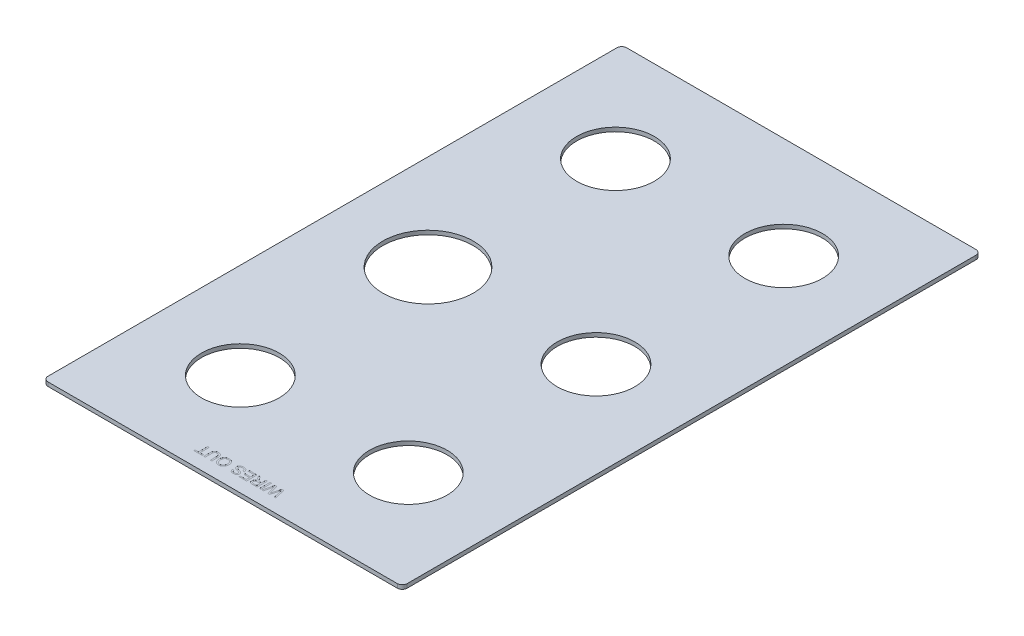
from build123d import *

# Parameters (mm, degrees)
SKETCH1_R           = 24.727
SKETCH1_R_2         = 28.76928198
BOSS_EXTRUDE1_DEPTH = 2.54
SKETCH2_W           = 0.941716851
SKETCH2_H           = 6.677628581
CUT_EXTRUDE2_DEPTH  = 0.0254


with BuildPart() as part:
    # Sketch1 → Boss-Extrude1 (new body)
    with BuildSketch(Plane(origin=(0, 0, 0), x_dir=(1, 0, 0), z_dir=(0, 1, 0))):
        with BuildLine():
            Line((-111.125, 184.15), (111.125, 184.15))
            ThreePointArc((111.125, 184.15), (113.37006403, 183.22006403), (114.3, 180.975))
            Line((114.3, 180.975), (114.3, -180.975))
            ThreePointArc((114.3, -180.975), (113.37006403, -183.22006403), (111.125, -184.15))
            Line((111.125, -184.15), (-111.125, -184.15))
            ThreePointArc((-111.125, -184.15), (-113.37006403, -183.22006403), (-114.3, -180.975))
            Line((-114.3, -180.975), (-114.3, 180.975))
            ThreePointArc((-114.3, 180.975), (-113.37006403, 183.22006403), (-111.125, 184.15))
        make_face()
        with Locations((53.5178, -119.508581684)):
            Circle(SKETCH1_R, mode=Mode.SUBTRACT)
        with Locations((53.5178, -0.064290842)):
            Circle(SKETCH1_R, mode=Mode.SUBTRACT)
        with Locations((-53.5178, -119.38)):
            Circle(SKETCH1_R, mode=Mode.SUBTRACT)
        with Locations((-53.5178, 119.38)):
            Circle(SKETCH1_R, mode=Mode.SUBTRACT)
        with Locations((53.5178, 119.38)):
            Circle(SKETCH1_R, mode=Mode.SUBTRACT)
        with Locations((-53.5178, 0.064290842)):
            Circle(SKETCH1_R_2, mode=Mode.SUBTRACT)
    extrude(amount=BOSS_EXTRUDE1_DEPTH)

    # Sketch2 → Cut-Extrude2 (cut)
    # profile 1 of 8: a face of its own
    with BuildSketch(Plane(origin=(0, 2.54, 0), x_dir=(1, 0, 0), z_dir=(0, 1, 0))):
        with BuildLine():
            Line((23.632943238, -168.91), (25.314389377, -175.587628581))
            Line((25.314389377, -175.587628581), (24.341906208, -175.587628581))
            Line((24.341906208, -175.587628581), (23.350695716, -171.196071163))
            add(Edge.make_bspline(
                [(23.350695716, -171.196071163), (23.299325023, -170.969580808), (23.19710809, -170.518912379), (23.096001693, -170.067993508), (23.045707872, -169.843690855)],
                knots=[0, 0, 0, 0, 1.00513078, 2, 2, 2, 2], degree=3))
            add(Edge.make_bspline(
                [(23.045707872, -169.843690855), (23.021895326, -169.924344538), (22.976941578, -170.076603994), (22.916172822, -170.292446444), (22.860978508, -170.480827734), (22.813955785, -170.642626067), (22.775881668, -170.778068762), (22.743008908, -170.885491505), (22.720603246, -170.966997983), (22.70732561, -171.011932775), (22.701927715, -171.030200581)],
                knots=[0, 0, 0, 0, 1.633809233, 3.084334118, 4.356383392, 5.447555203, 6.357852567, 7.089694452, 7.629924063, 8, 8, 8, 8], degree=3))
            Line((22.701927715, -171.030200581), (21.382989057, -175.587628581))
            Line((21.382989057, -175.587628581), (20.24998597, -175.587628581))
            Line((20.24998597, -175.587628581), (19.296230125, -172.24212596))
            add(Edge.make_bspline(
                [(19.296230125, -172.24212596), (19.243596084, -172.03545393), (19.139813145, -171.627941413), (19.001920759, -171.020936424), (18.874650495, -170.428657498), (18.801340432, -170.036929476), (18.765176731, -169.843690855)],
                knots=[0, 0, 0, 0, 1.04154457, 2.053700482, 3.039894486, 4, 4, 4, 4], degree=3))
            add(Edge.make_bspline(
                [(18.765176731, -169.843690855), (18.742796194, -169.942212876), (18.695517606, -170.150339344), (18.622811501, -170.478808574), (18.540293141, -170.839224554), (18.484149649, -171.09036912), (18.454838223, -171.221486816)],
                knots=[0, 0, 0, 0, 0.858436457, 1.813435672, 2.858437265, 4, 4, 4, 4], degree=3))
            Line((18.454838223, -171.221486816), (17.468978394, -175.587628581))
            Line((17.468978394, -175.587628581), (16.496495226, -175.587628581))
            Line((16.496495226, -175.587628581), (18.179279031, -168.91))
            Line((18.179279031, -168.91), (19.214632501, -168.91))
            Line((19.214632501, -168.91), (20.609818119, -174.01319572))
            add(Edge.make_bspline(
                [(20.609818119, -174.01319572), (20.623827793, -174.063084201), (20.650440955, -174.157853738), (20.685324579, -174.29309308), (20.719917615, -174.412030516), (20.747432964, -174.516203119), (20.771245195, -174.604561153), (20.792331944, -174.676845919), (20.805894374, -174.734472146), (20.815702094, -174.76722518), (20.819831679, -174.781015994)],
                knots=[0, 0, 0, 0, 1.562239628, 2.967673567, 4.210417925, 5.296319877, 6.215971374, 6.969386481, 7.566055473, 8, 8, 8, 8], degree=3))
            add(Edge.make_bspline(
                [(20.819831679, -174.781015994), (20.844657297, -174.693580195), (20.891682413, -174.527957792), (20.960166786, -174.295091919), (21.019046174, -174.090752029), (21.055687775, -173.96458835), (21.072650549, -173.906182442)],
                knots=[0, 0, 0, 0, 1.197732026, 2.268764715, 3.198546125, 4, 4, 4, 4], degree=3))
            Line((21.072650549, -173.906182442), (22.518667475, -168.91))
            Line((22.518667475, -168.91), (23.632943238, -168.91))
        make_face()
    # profile 2 of 8: a face of its own
    with BuildSketch(Plane(origin=(0, 2.54, 0), x_dir=(1, 0, 0), z_dir=(0, 1, 0))):
        with Locations((15.340751818, -172.248814291)):
            Rectangle(SKETCH2_W, SKETCH2_H)
    # profile 3 of 8: a face of its own
    with BuildSketch(Plane(origin=(0, 2.54, 0), x_dir=(1, 0, 0), z_dir=(0, 1, 0))):
        with BuildLine():
            Line((13.328902181, -168.91), (13.328902181, -175.587628581))
            Line((13.328902181, -175.587628581), (10.431517665, -175.587628581))
            add(Edge.make_bspline(
                [(10.431517665, -175.587628581), (10.363292806, -175.587096546), (10.231251578, -175.586066856), (10.03976983, -175.578708935), (9.861463117, -175.563077027), (9.695207674, -175.545618097), (9.541287988, -175.519839646), (9.399630705, -175.489596873), (9.270779114, -175.453853433), (9.153752793, -175.411603204), (9.045169062, -175.363819062), (8.944548789, -175.304828573), (8.847571535, -175.240298913), (8.758103027, -175.163854788), (8.672113635, -175.08172384), (8.593203482, -174.989796624), (8.519037225, -174.890373993), (8.428860855, -174.746400185), (8.334151114, -174.553413553), (8.252576009, -174.308226002), (8.200705014, -174.05148519), (8.195105726, -173.876110271), (8.192264811, -173.787130169)],
                knots=[0, 0, 0, 0, 1.242075696, 2.40389213, 3.487198984, 4.500157661, 5.446319301, 6.326791195, 7.136300648, 7.878370406, 8.590488565, 9.292260633, 9.999224673, 10.708050372, 11.431369221, 12.162165018, 12.910600795, 13.687589445, 15.252257874, 16.810406251, 18.381693487, 20, 20, 20, 20], degree=3))
            add(Edge.make_bspline(
                [(8.192264811, -173.787130169), (8.193571517, -173.730008672), (8.19615235, -173.617189797), (8.215921505, -173.45131567), (8.251692958, -173.292830312), (8.297560289, -173.14034246), (8.360348032, -172.996024572), (8.433051662, -172.856884453), (8.523248176, -172.726910071), (8.623957418, -172.601757556), (8.741064038, -172.487074803), (8.871326311, -172.381080347), (9.018660448, -172.290119283), (9.178234156, -172.205586967), (9.354159906, -172.136163929), (9.54378457, -172.075034695), (9.748575738, -172.02790233), (9.890519546, -172.004161241), (9.963334571, -171.991982422)],
                knots=[0, 0, 0, 0, 0.982645791, 1.940792824, 2.867691729, 3.775150443, 4.675643875, 5.571354211, 6.471357401, 7.392684514, 8.331098131, 9.285922955, 10.275520706, 11.304845665, 12.388884831, 13.524255008, 14.729980297, 16, 16, 16, 16], degree=3))
            add(Edge.make_bspline(
                [(9.963334571, -171.991982422), (9.909404212, -171.965100634), (9.80713011, -171.914121729), (9.667956952, -171.829773388), (9.546035076, -171.750366643), (9.476778417, -171.69082278), (9.44432017, -171.66291659)],
                knots=[0, 0, 0, 0, 1.172551213, 2.223638478, 3.167479604, 4, 4, 4, 4], degree=3))
            add(Edge.make_bspline(
                [(9.44432017, -171.66291659), (9.381132019, -171.601164157), (9.251543527, -171.474520084), (9.074703105, -171.256807636), (8.899721615, -171.017386254), (8.794666383, -170.842915484), (8.740707864, -170.753303723)],
                knots=[0, 0, 0, 0, 0.918170575, 1.883016652, 2.912673989, 4, 4, 4, 4], degree=3))
            Line((8.740707864, -170.753303723), (7.645159425, -168.91))
            Line((7.645159425, -168.91), (8.724655872, -168.91))
            Line((8.724655872, -168.91), (9.556684113, -170.319899945))
            add(Edge.make_bspline(
                [(9.556684113, -170.319899945), (9.586601501, -170.369366751), (9.644576487, -170.465225299), (9.728289267, -170.605242248), (9.810477346, -170.734077121), (9.886334988, -170.85574056), (9.960672974, -170.96702405), (10.027312005, -171.072139162), (10.094234973, -171.165131078), (10.171077393, -171.276850283), (10.264921144, -171.397638948), (10.374430167, -171.52172404), (10.475116427, -171.624510619), (10.602349215, -171.722582681), (10.760556516, -171.812377229), (10.893947832, -171.85497336), (10.958558061, -171.875605481)],
                knots=[0, 0, 0, 0, 1.130591283, 2.190900266, 3.190104209, 4.119071823, 4.994606968, 5.807262858, 6.55236009, 7.234593472, 8.459046683, 9.540234366, 10.471327768, 11.266723835, 12.676093724, 14, 14, 14, 14], degree=3))
            add(Edge.make_bspline(
                [(10.958558061, -171.875605481), (10.985700699, -171.880500221), (11.047668153, -171.891675059), (11.152888735, -171.898973364), (11.28037638, -171.906719538), (11.372768849, -171.90649384), (11.422728157, -171.906371799)],
                knots=[0, 0, 0, 0, 0.709978628, 1.620902492, 2.713552433, 4, 4, 4, 4], degree=3))
            Line((11.422728157, -171.906371799), (12.38718533, -171.906371799))
            Line((12.38718533, -171.906371799), (12.38718533, -168.91))
            Line((12.38718533, -168.91), (13.328902181, -168.91))
        make_face()
        with BuildLine():
            Line((12.38718533, -172.676867405), (10.598725912, -172.676867405))
            add(Edge.make_bspline(
                [(10.598725912, -172.676867405), (10.509041729, -172.678258399), (10.341385561, -172.680858734), (10.10700453, -172.703403287), (9.906514669, -172.738643655), (9.737355011, -172.792167838), (9.595192811, -172.86384728), (9.4719805, -172.951504301), (9.368380463, -173.060253453), (9.28317838, -173.184950494), (9.216573602, -173.320844399), (9.170033561, -173.464671415), (9.138788207, -173.613673587), (9.135593421, -173.715629033), (9.133981662, -173.76706518)],
                knots=[0, 0, 0, 0, 1.546056516, 2.890207646, 4.055830773, 5.050253158, 5.937355789, 6.790906573, 7.644595853, 8.512568064, 9.38593768, 10.244184789, 11.114197691, 12, 12, 12, 12], degree=3))
            add(Edge.make_bspline(
                [(9.133981662, -173.76706518), (9.135218998, -173.804549755), (9.137642576, -173.877971028), (9.150482994, -173.985697904), (9.174913004, -174.087786542), (9.208647521, -174.184972845), (9.251360342, -174.27746782), (9.303847642, -174.364907678), (9.36583859, -174.446845812), (9.436949475, -174.523685608), (9.518568997, -174.593612923), (9.611805656, -174.653942185), (9.715914915, -174.705209834), (9.83102038, -174.745899051), (9.956758704, -174.778443865), (10.093845904, -174.800094864), (10.241654987, -174.815761459), (10.344078112, -174.816667262), (10.396738349, -174.817132975)],
                knots=[0, 0, 0, 0, 0.965235723, 1.89061323, 2.787065514, 3.661873922, 4.534873316, 5.404925039, 6.281839248, 7.175200054, 8.095223355, 9.040740021, 10.02630299, 11.075573487, 12.177989335, 13.364883635, 14.645170704, 16, 16, 16, 16], degree=3))
            Line((10.396738349, -174.817132975), (12.38718533, -174.817132975))
            Line((12.38718533, -174.817132975), (12.38718533, -172.676867405))
        make_face(mode=Mode.SUBTRACT)
    # profile 4 of 8: a face of its own
    with BuildSketch(Plane(origin=(0, 2.54, 0), x_dir=(1, 0, 0), z_dir=(0, 1, 0))):
        Polygon((6.6512736, -168.91), (6.6512736, -175.587628581), (1.942689345, -175.587628581), (1.942689345, -174.817132975), (5.709556749, -174.817132975), (5.709556749, -172.762478027), (2.199521213, -172.762478027), (2.199521213, -171.991982422), (5.709556749, -171.991982422), (5.709556749, -169.680495605), (1.771468099, -169.680495605), (1.771468099, -168.91), align=None)
    # profile 5 of 8: a face of its own
    with BuildSketch(Plane(origin=(0, 2.54, 0), x_dir=(1, 0, 0), z_dir=(0, 1, 0))):
        with BuildLine():
            Line((0.829751248, -171.221486816), (-0.111965603, -171.221486816))
            add(Edge.make_bspline(
                [(-0.111965603, -171.221486816), (-0.122300306, -171.136920767), (-0.142153826, -170.974464831), (-0.198105729, -170.744412505), (-0.268592025, -170.537033889), (-0.361338467, -170.352541821), (-0.475255133, -170.186545829), (-0.617782751, -170.039543528), (-0.788933822, -169.910501137), (-0.984673261, -169.800161916), (-1.198851792, -169.707216884), (-1.429578835, -169.642014332), (-1.673439367, -169.602475454), (-1.840524353, -169.597450703), (-1.925840675, -169.594884983)],
                knots=[0, 0, 0, 0, 1.125761249, 2.162647979, 3.12492346, 4.01623828, 4.884793378, 5.777219259, 6.711258599, 7.709587174, 8.742442187, 9.791331093, 10.872217593, 12, 12, 12, 12], degree=3))
            add(Edge.make_bspline(
                [(-1.925840675, -169.594884983), (-2.00132428, -169.596288662), (-2.148061054, -169.599017353), (-2.361175224, -169.631583172), (-2.561144255, -169.679761442), (-2.745807794, -169.749052862), (-2.911454681, -169.836152826), (-3.058487465, -169.935607161), (-3.180435603, -170.054131077), (-3.279079502, -170.185129954), (-3.35563269, -170.324239119), (-3.409002883, -170.467751543), (-3.444935193, -170.612872597), (-3.448840901, -170.711184835), (-3.450779894, -170.759992053)],
                knots=[0, 0, 0, 0, 1.267544124, 2.464049433, 3.614542348, 4.719673496, 5.768837234, 6.754183997, 7.692231426, 8.612479311, 9.501217876, 10.350240008, 11.180974857, 12, 12, 12, 12], degree=3))
            add(Edge.make_bspline(
                [(-3.450779894, -170.759992053), (-3.448734217, -170.808320403), (-3.444731839, -170.90287513), (-3.41298182, -171.039749764), (-3.361676939, -171.167107787), (-3.289708786, -171.286035669), (-3.191897669, -171.39581424), (-3.065416139, -171.493264907), (-2.913787566, -171.585956174), (-2.799626619, -171.635388546), (-2.739141591, -171.661578924)],
                knots=[0, 0, 0, 0, 0.942081658, 1.843188798, 2.725198023, 3.611401405, 4.541884661, 5.575766242, 6.715586633, 8, 8, 8, 8], degree=3))
            add(Edge.make_bspline(
                [(-2.739141591, -171.661578924), (-2.715616019, -171.671233178), (-2.662467478, -171.693043891), (-2.571372485, -171.721914532), (-2.463281361, -171.75926362), (-2.335982467, -171.797529049), (-2.189343903, -171.83852873), (-2.02471077, -171.885712807), (-1.840776969, -171.934847595), (-1.643984004, -171.986863987), (-1.444785638, -172.039623623), (-1.254502177, -172.093569336), (-1.078352587, -172.144734389), (-0.917007378, -172.197320494), (-0.770312038, -172.249221233), (-0.637865794, -172.300101227), (-0.519433039, -172.34869434), (-0.447100591, -172.384431007), (-0.412940449, -172.401308212)],
                knots=[0, 0, 0, 0, 0.499208779, 1.12780332, 1.87546358, 2.745246929, 3.737578632, 4.865834649, 6.108484299, 7.476352792, 8.863398792, 10.155242256, 11.360521946, 12.465428895, 13.487415091, 14.415997097, 15.251929613, 16, 16, 16, 16], degree=3))
            add(Edge.make_bspline(
                [(-0.412940449, -172.401308212), (-0.33439709, -172.443817677), (-0.182787966, -172.525872006), (0.022051427, -172.671714273), (0.19175084, -172.836704186), (0.331696087, -173.014473096), (0.439742994, -173.205942272), (0.516080243, -173.409014609), (0.565656107, -173.622897826), (0.570471317, -173.769909024), (0.572919379, -173.844649807)],
                knots=[0, 0, 0, 0, 1.158956011, 2.237086722, 3.252429106, 4.221720014, 5.165272549, 6.094237939, 7.031106807, 8, 8, 8, 8], degree=3))
            add(Edge.make_bspline(
                [(0.572919379, -173.844649807), (0.5697455, -173.927437968), (0.563432677, -174.092103021), (0.507294577, -174.333691375), (0.417883054, -174.56692136), (0.314888491, -174.751512006), (0.215916434, -174.891668806), (0.132735448, -174.991049213), (0.04094839, -175.083472006), (-0.057437483, -175.170854779), (-0.165974497, -175.249930177), (-0.281411584, -175.323343203), (-0.406113443, -175.38912905), (-0.582665272, -175.469334226), (-0.817493636, -175.551565656), (-1.113162554, -175.622810202), (-1.424366052, -175.664515975), (-1.636779572, -175.670290332), (-1.745255767, -175.673239204)],
                knots=[0, 0, 0, 0, 1.200056028, 2.386902731, 3.579012093, 4.815906327, 5.442508847, 6.067203999, 6.694073756, 7.331409728, 7.974631341, 8.640655778, 9.315145047, 10.018831381, 11.453504181, 12.917815188, 14.425977399, 16, 16, 16, 16], degree=3))
            add(Edge.make_bspline(
                [(-1.745255767, -175.673239204), (-1.864008344, -175.670604036), (-2.094800286, -175.665482671), (-2.430387838, -175.620316752), (-2.744325301, -175.547538362), (-2.990076794, -175.461794803), (-3.172239093, -175.376566745), (-3.300639933, -175.307887436), (-3.420230957, -175.230485202), (-3.533294276, -175.14853061), (-3.635789241, -175.056685259), (-3.731948999, -174.959779443), (-3.820155827, -174.855945122), (-3.924903958, -174.707643741), (-4.03554884, -174.509311317), (-4.135470952, -174.254928517), (-4.199457348, -173.984452318), (-4.213925457, -173.798607284), (-4.221275499, -173.704194878)],
                knots=[0, 0, 0, 0, 1.607451709, 3.124032445, 4.575401297, 5.965664223, 6.638286369, 7.297495781, 7.935629741, 8.566004073, 9.186263309, 9.796807256, 10.413736732, 11.028594479, 12.253110936, 13.478624344, 14.719098735, 16, 16, 16, 16], degree=3))
            Line((-4.221275499, -173.704194878), (-3.279558648, -173.704194878))
            add(Edge.make_bspline(
                [(-3.279558648, -173.704194878), (-3.273771602, -173.752058718), (-3.262436422, -173.845810392), (-3.230636994, -173.980547909), (-3.192600267, -174.10710359), (-3.144232188, -174.224055068), (-3.086506247, -174.332436506), (-3.018033712, -174.431011758), (-2.94152464, -174.521646465), (-2.85513315, -174.602750037), (-2.758041884, -174.673975704), (-2.650230509, -174.735532482), (-2.532098757, -174.788145122), (-2.402500751, -174.828705316), (-2.26316937, -174.862387332), (-2.112501629, -174.886565121), (-1.951024251, -174.899089809), (-1.839803256, -174.901504216), (-1.782710414, -174.902743598)],
                knots=[0, 0, 0, 0, 1.074256797, 2.104164074, 3.082231143, 4.018364317, 4.921387537, 5.814946689, 6.689553043, 7.561782592, 8.450683137, 9.368204304, 10.325224224, 11.328240899, 12.391723181, 13.519579538, 14.726730929, 16, 16, 16, 16], degree=3))
            add(Edge.make_bspline(
                [(-1.782710414, -174.902743598), (-1.723364228, -174.902302171), (-1.608484606, -174.901447678), (-1.442447663, -174.885584388), (-1.288428272, -174.864200282), (-1.147375889, -174.8313749), (-1.017974289, -174.79275508), (-0.902493225, -174.740895859), (-0.798180298, -174.682436669), (-0.706937899, -174.61391263), (-0.62829401, -174.537943815), (-0.557710091, -174.459906863), (-0.500797494, -174.375719234), (-0.450683023, -174.290042614), (-0.415765366, -174.198320253), (-0.388355797, -174.104542703), (-0.371689275, -174.006649151), (-0.369774726, -173.940134121), (-0.368797472, -173.906182442)],
                knots=[0, 0, 0, 0, 1.464224776, 2.834379057, 4.11387117, 5.299348816, 6.406355048, 7.441191667, 8.417293255, 9.352838038, 10.248153785, 11.113750317, 11.944205591, 12.75240885, 13.557683963, 14.358962649, 15.162355132, 16, 16, 16, 16], degree=3))
            add(Edge.make_bspline(
                [(-0.368797472, -173.906182442), (-0.37123109, -173.848731061), (-0.375954518, -173.737223227), (-0.424187626, -173.578804208), (-0.498370483, -173.434395009), (-0.571452417, -173.3558227), (-0.608239683, -173.316271744)],
                knots=[0, 0, 0, 0, 1.050964922, 2.039826012, 3.013306874, 4, 4, 4, 4], degree=3))
            add(Edge.make_bspline(
                [(-0.608239683, -173.316271744), (-0.631429982, -173.296506065), (-0.682713897, -173.252795485), (-0.778135549, -173.194949737), (-0.89644413, -173.136503535), (-1.038430802, -173.078405591), (-1.203848303, -173.019938836), (-1.392443217, -172.959783733), (-1.605290389, -172.899729949), (-1.835341443, -172.842797028), (-2.06742145, -172.784340103), (-2.287668031, -172.726739864), (-2.490671798, -172.672911415), (-2.674095348, -172.616871264), (-2.840956873, -172.567716205), (-2.987948727, -172.515816054), (-3.11771171, -172.468717275), (-3.19717772, -172.435472738), (-3.234078005, -172.420035536)],
                knots=[0, 0, 0, 0, 0.523895407, 1.158562347, 1.913798076, 2.79478753, 3.797549825, 4.933675542, 6.202127117, 7.604032848, 9.013379355, 10.32225155, 11.523321485, 12.628397413, 13.623935419, 14.51727859, 15.311493772, 16, 16, 16, 16], degree=3))
            add(Edge.make_bspline(
                [(-3.234078005, -172.420035536), (-3.282099123, -172.397911246), (-3.376356532, -172.354484974), (-3.509729216, -172.280126565), (-3.634989015, -172.203572345), (-3.748235425, -172.119213657), (-3.855033152, -172.034742137), (-3.949935026, -171.943421237), (-4.03498244, -171.847399774), (-4.135724875, -171.715469781), (-4.239063497, -171.53739795), (-4.32785, -171.307252493), (-4.383388253, -171.061361326), (-4.389423008, -170.891824444), (-4.392496745, -170.805472696)],
                knots=[0, 0, 0, 0, 0.899363591, 1.76530001, 2.59691609, 3.395188894, 4.166615117, 4.912545108, 5.632755751, 6.347510175, 7.734752518, 9.118421309, 10.532299558, 12, 12, 12, 12], degree=3))
            add(Edge.make_bspline(
                [(-4.392496745, -170.805472696), (-4.38895673, -170.718216064), (-4.381910949, -170.544547011), (-4.323029718, -170.288939319), (-4.228552762, -170.041766988), (-4.119204846, -169.845674821), (-4.015428246, -169.695673965), (-3.928279472, -169.587851279), (-3.831628839, -169.488155207), (-3.727864782, -169.393458837), (-3.616178846, -169.30569683), (-3.495631673, -169.224832572), (-3.367489359, -169.150049501), (-3.184530779, -169.058819838), (-2.941241491, -168.964081688), (-2.632292045, -168.881909663), (-2.305506818, -168.833218795), (-2.081621479, -168.827373774), (-1.96730832, -168.824389377)],
                knots=[0, 0, 0, 0, 1.196987384, 2.382393894, 3.582009067, 4.820735309, 5.454243406, 6.085350439, 6.72189866, 7.359035515, 8.013098289, 8.67027723, 9.350744424, 10.048966745, 11.475869723, 12.9268444, 14.430883741, 16, 16, 16, 16], degree=3))
            add(Edge.make_bspline(
                [(-1.96730832, -168.824389377), (-1.894611976, -168.825066361), (-1.751765216, -168.82639662), (-1.542326645, -168.839585244), (-1.342192809, -168.863413354), (-1.150563024, -168.89099369), (-0.968341294, -168.932446252), (-0.794482035, -168.979218191), (-0.63057113, -169.037895171), (-0.474803619, -169.102452696), (-0.328605544, -169.178733963), (-0.188907253, -169.260489596), (-0.059089327, -169.354273292), (0.064694543, -169.453730246), (0.178709516, -169.564374285), (0.284274783, -169.683623433), (0.382537737, -169.811206702), (0.471756298, -169.94726202), (0.551403598, -170.090229329), (0.623106063, -170.237623704), (0.683111758, -170.390231372), (0.732561435, -170.547693563), (0.773039531, -170.709295471), (0.801901647, -170.876113556), (0.822853734, -171.04710129), (0.827438496, -171.163014962), (0.829751248, -171.221486816)],
                knots=[0, 0, 0, 0, 1.259929758, 2.475735005, 3.634725603, 4.752877801, 5.82919746, 6.871690464, 7.871395985, 8.84458164, 9.791640072, 10.727373556, 11.647336026, 12.564665335, 13.477425593, 14.397128332, 15.323044476, 16.266184727, 17.214251675, 18.157898412, 19.105082968, 20.053433368, 21.01687335, 21.990151059, 22.98614553, 24, 24, 24, 24], degree=3))
        make_face()
    # profile 6 of 8: a face of its own
    with BuildSketch(Plane(origin=(0, 2.54, 0), x_dir=(1, 0, 0), z_dir=(0, 1, 0))):
        with BuildLine():
            add(Edge.make_bspline(
                [(-7.902532281, -172.160528336), (-7.904868823, -172.294404113), (-7.909421457, -172.555254276), (-7.95145786, -172.935167661), (-8.020805874, -173.292189836), (-8.116201245, -173.627972316), (-8.243080235, -173.939982669), (-8.393628601, -174.232057602), (-8.576292795, -174.499113512), (-8.782691478, -174.744238191), (-9.013292565, -174.960926501), (-9.258801186, -175.153382006), (-9.5223022, -175.313911345), (-9.801356042, -175.446456), (-10.097149626, -175.54821986), (-10.408852094, -175.619463844), (-10.73613018, -175.665423132), (-10.959832408, -175.670596003), (-11.074138323, -175.673239204)],
                knots=[0, 0, 0, 0, 1.203593535, 2.345140965, 3.431924157, 4.471254512, 5.478692091, 6.45615896, 7.42038538, 8.382007041, 9.33218277, 10.260966195, 11.182476517, 12.100814648, 13.034113903, 13.98924309, 14.972556454, 16, 16, 16, 16], degree=3))
            add(Edge.make_bspline(
                [(-11.074138323, -175.673239204), (-11.149533304, -175.671934631), (-11.2992541, -175.669343985), (-11.521000104, -175.649238618), (-11.736781479, -175.614330091), (-11.946724691, -175.565766742), (-12.151139417, -175.504669011), (-12.349890712, -175.429209665), (-12.543296166, -175.340933857), (-12.72962409, -175.238335871), (-12.907551192, -175.122886619), (-13.076351255, -174.997786024), (-13.233401839, -174.860524933), (-13.379460856, -174.712925043), (-13.515657342, -174.555062251), (-13.637638745, -174.383988246), (-13.752624989, -174.205105922), (-13.853438417, -174.014308827), (-13.944828148, -173.81598128), (-14.021432258, -173.609263699), (-14.089271715, -173.397118639), (-14.144048276, -173.178228466), (-14.184879158, -172.951968662), (-14.216276445, -172.719965089), (-14.233230262, -172.480928323), (-14.236209714, -172.319734193), (-14.23771837, -172.238112963)],
                knots=[0, 0, 0, 0, 1.034176269, 2.053687022, 3.051235935, 4.030520976, 5.007759882, 5.975670013, 6.944584641, 7.921900115, 8.890679583, 9.85222947, 10.801660264, 11.7488817, 12.698942795, 13.658174729, 14.62880618, 15.613957309, 16.61577279, 17.622338666, 18.636016077, 19.670029534, 20.714984856, 21.788550191, 22.880224384, 24, 24, 24, 24], degree=3))
            add(Edge.make_bspline(
                [(-14.23771837, -172.238112963), (-14.23632704, -172.155147409), (-14.233578228, -171.991234652), (-14.214978638, -171.749085358), (-14.182274095, -171.513887669), (-14.138897087, -171.284940267), (-14.08077322, -171.062719774), (-14.011701935, -170.846589067), (-13.928156318, -170.637835469), (-13.833800806, -170.435955826), (-13.727037631, -170.243726737), (-13.609270434, -170.062492165), (-13.480416558, -169.893948118), (-13.342430464, -169.736024416), (-13.192553381, -169.591989944), (-13.031942973, -169.459700845), (-12.860927681, -169.339726304), (-12.680177856, -169.23135865), (-12.492581258, -169.136071154), (-12.300415691, -169.051863457), (-12.103454523, -168.983732216), (-11.904579332, -168.923302758), (-11.700828725, -168.879850893), (-11.494123972, -168.847472249), (-11.283166388, -168.828538825), (-11.141503927, -168.825779634), (-11.070125326, -168.824389377)],
                knots=[0, 0, 0, 0, 1.141458971, 2.255149016, 3.338763392, 4.407145747, 5.45911027, 6.497028761, 7.526847988, 8.550472592, 9.561035647, 10.549629976, 11.521388012, 12.477647518, 13.432134385, 14.377847498, 15.337760086, 16.303574593, 17.274809663, 18.230970776, 19.187525402, 20.140611526, 21.088808525, 22.051011914, 23.017975238, 24, 24, 24, 24], degree=3))
            add(Edge.make_bspline(
                [(-11.070125326, -168.824389377), (-10.993387527, -168.825578265), (-10.841389166, -168.827933154), (-10.616494071, -168.849614076), (-10.397937614, -168.88672926), (-10.184469546, -168.93331902), (-9.978465382, -168.998729636), (-9.778201489, -169.075799462), (-9.585162533, -169.169065442), (-9.398356806, -169.274423347), (-9.219457707, -169.39122805), (-9.052258186, -169.52060398), (-8.894291212, -169.6580082), (-8.750367804, -169.808767929), (-8.616177575, -169.968166885), (-8.492171182, -170.137588378), (-8.380100815, -170.317881087), (-8.280587519, -170.508080587), (-8.190852932, -170.703360022), (-8.115208666, -170.90361748), (-8.048743226, -171.105945631), (-7.995807462, -171.311579843), (-7.953624841, -171.520048878), (-7.92525991, -171.731005018), (-7.90477459, -171.944762669), (-7.903283479, -172.088244511), (-7.902532281, -172.160528336)],
                knots=[0, 0, 0, 0, 1.072846099, 2.125039441, 3.155166917, 4.171599398, 5.177324298, 6.174217088, 7.169783185, 8.172042761, 9.17156421, 10.154239632, 11.126115549, 12.096189878, 13.065322046, 14.038037562, 15.029377678, 16.03062832, 17.03785952, 18.032507603, 19.022297599, 20.014323703, 20.999862951, 21.994471951, 22.989647507, 24, 24, 24, 24], degree=3))
        make_face()
        with BuildLine():
            add(Edge.make_bspline(
                [(-8.844249132, -172.149827008), (-8.845691451, -172.053420401), (-8.848503871, -171.865434323), (-8.880709052, -171.591367712), (-8.929517803, -171.332745434), (-8.996992393, -171.088962695), (-9.0870792, -170.861811602), (-9.197220938, -170.650855955), (-9.32641992, -170.455098662), (-9.474608164, -170.276758173), (-9.637434381, -170.116495336), (-9.811433573, -169.976453044), (-9.996444093, -169.859676631), (-10.190016428, -169.762138022), (-10.394717097, -169.686984881), (-10.609565389, -169.633858343), (-10.83455709, -169.60069725), (-10.98796563, -169.596846543), (-11.066112328, -169.594884983)],
                knots=[0, 0, 0, 0, 1.215616022, 2.370365452, 3.475740397, 4.533490648, 5.5560781, 6.552384115, 7.530550651, 8.509299237, 9.471863928, 10.40830403, 11.321168121, 12.226759389, 13.137923578, 14.065605683, 15.014614662, 16, 16, 16, 16], degree=3))
            add(Edge.make_bspline(
                [(-11.066112328, -169.594884983), (-11.145584318, -169.59687414), (-11.301190252, -169.600768903), (-11.529564036, -169.633370577), (-11.746544715, -169.688873529), (-11.954282865, -169.762760558), (-12.149023112, -169.862643127), (-12.335318626, -169.979605429), (-12.508095682, -170.122528616), (-12.671577088, -170.283079607), (-12.818263713, -170.465554814), (-12.948207868, -170.665555052), (-13.054493607, -170.8855657), (-13.143154965, -171.12242268), (-13.21270247, -171.377612405), (-13.261322688, -171.651132636), (-13.291306379, -171.942262372), (-13.294408799, -172.142171822), (-13.296001519, -172.244801292)],
                knots=[0, 0, 0, 0, 0.976909331, 1.912785716, 2.828990727, 3.727421029, 4.617481149, 5.514840137, 6.426786422, 7.368873452, 8.327895072, 9.299698503, 10.295216142, 11.325792517, 12.405818789, 13.542541501, 14.738390493, 16, 16, 16, 16], degree=3))
            add(Edge.make_bspline(
                [(-13.296001519, -172.244801292), (-13.295432936, -172.310823356), (-13.294317582, -172.440334751), (-13.279546538, -172.631236025), (-13.260493814, -172.816199196), (-13.231485645, -172.994985502), (-13.191509057, -173.166854888), (-13.147220595, -173.333114569), (-13.091843858, -173.492336242), (-13.028995551, -173.645128244), (-12.958725969, -173.790764274), (-12.879266751, -173.927807016), (-12.79230587, -174.056711184), (-12.69694247, -174.17690135), (-12.595587364, -174.290074697), (-12.48501404, -174.393289023), (-12.367044024, -174.488597735), (-12.241662552, -174.575025805), (-12.110881776, -174.652718043), (-11.975365427, -174.719721399), (-11.835545168, -174.776527398), (-11.691564755, -174.821039592), (-11.544290507, -174.857788881), (-11.393367263, -174.885010337), (-11.237612443, -174.899281733), (-11.132575308, -174.901581356), (-11.079488987, -174.902743598)],
                knots=[0, 0, 0, 0, 1.220320263, 2.393826742, 3.538159925, 4.657606474, 5.739544833, 6.799495376, 7.837090465, 8.853610905, 9.852768056, 10.824163015, 11.779900663, 12.724912201, 13.658747054, 14.586045767, 15.518168864, 16.460299482, 17.399069918, 18.328125852, 19.252745725, 20.186143833, 21.111865538, 22.057883325, 23.018444021, 24, 24, 24, 24], degree=3))
            add(Edge.make_bspline(
                [(-11.079488987, -174.902743598), (-11.004461348, -174.901228359), (-10.855981652, -174.8982297), (-10.63802316, -174.865825669), (-10.427655857, -174.817041995), (-10.226347354, -174.746576448), (-10.031803252, -174.658111997), (-9.846262357, -174.547970392), (-9.668543877, -174.418461794), (-9.499403075, -174.270137272), (-9.341758209, -174.09901986), (-9.208411133, -173.897407891), (-9.096043603, -173.669968126), (-9.002212749, -173.417318896), (-8.930671151, -173.137491444), (-8.881226496, -172.831693578), (-8.850008279, -172.499601999), (-8.846217925, -172.269399341), (-8.844249132, -172.149827008)],
                knots=[0, 0, 0, 0, 0.895098135, 1.771399171, 2.624879489, 3.470001555, 4.31324378, 5.172350046, 6.041214072, 6.935108351, 7.854676913, 8.809932058, 9.809814619, 10.877726151, 12.02168834, 13.252153056, 14.572707754, 16, 16, 16, 16], degree=3))
        make_face(mode=Mode.SUBTRACT)
    # profile 7 of 8: a face of its own
    with BuildSketch(Plane(origin=(0, 2.54, 0), x_dir=(1, 0, 0), z_dir=(0, 1, 0))):
        with BuildLine():
            Line((-19.631187609, -175.587628581), (-20.57290446, -175.587628581))
            Line((-20.57290446, -175.587628581), (-20.57290446, -171.745851881))
            add(Edge.make_bspline(
                [(-20.57290446, -171.745851881), (-20.57192501, -171.664247803), (-20.570019001, -171.505446134), (-20.561299934, -171.273844826), (-20.54415202, -171.055138552), (-20.518473348, -170.850000395), (-20.487784822, -170.657160187), (-20.451529682, -170.477269216), (-20.405329106, -170.31048789), (-20.353471363, -170.154985437), (-20.291719256, -170.009391707), (-20.218696545, -169.871618347), (-20.134771499, -169.740800183), (-20.038997968, -169.617225143), (-19.932898092, -169.500142704), (-19.815223272, -169.390478973), (-19.68544541, -169.288992677), (-19.546855025, -169.191847255), (-19.395802439, -169.104969249), (-19.232620143, -169.030031887), (-19.058355179, -168.965574542), (-18.872159021, -168.913754817), (-18.674886182, -168.87415287), (-18.46682239, -168.844540645), (-18.247453126, -168.827036747), (-18.097362537, -168.825284902), (-18.020637767, -168.824389377)],
                knots=[0, 0, 0, 0, 1.311377147, 2.551942077, 3.723550895, 4.835332178, 5.873100029, 6.860965504, 7.782222652, 8.65229484, 9.493385443, 10.320318369, 11.155067733, 11.987723446, 12.829729107, 13.691560723, 14.568860379, 15.475173283, 16.409214366, 17.364531151, 18.357450607, 19.391849073, 20.466818896, 21.588529868, 22.767281177, 24, 24, 24, 24], degree=3))
            add(Edge.make_bspline(
                [(-18.020637767, -168.824389377), (-17.945707184, -168.825492015), (-17.799710789, -168.827640419), (-17.585767701, -168.842176993), (-17.382254078, -168.867912541), (-17.188586558, -168.901766855), (-17.005718965, -168.947263096), (-16.833869804, -169.003868508), (-16.671919216, -169.069157223), (-16.519670433, -169.143700079), (-16.379396063, -169.230427823), (-16.24748194, -169.323051281), (-16.127830338, -169.427424286), (-16.018137536, -169.539614763), (-15.918239724, -169.660544816), (-15.83009427, -169.79136773), (-15.750285309, -169.930207297), (-15.684045049, -170.080651617), (-15.62424082, -170.24122443), (-15.574119498, -170.415302144), (-15.531322211, -170.602884958), (-15.497280422, -170.804405986), (-15.468391974, -171.019786753), (-15.4511903, -171.24981222), (-15.438263826, -171.493332251), (-15.436944188, -171.660221793), (-15.43626709, -171.745851881)],
                knots=[0, 0, 0, 0, 1.193078897, 2.324621146, 3.412165798, 4.458033356, 5.453301711, 6.409727336, 7.336550967, 8.231923267, 9.10494906, 9.959977801, 10.795507141, 11.62892236, 12.456145611, 13.289107106, 14.138012467, 15.002334476, 15.903094886, 16.864671381, 17.884255983, 18.965082669, 20.117808422, 21.342986352, 22.636701193, 24, 24, 24, 24], degree=3))
            Line((-15.43626709, -171.745851881), (-15.43626709, -175.587628581))
            Line((-15.43626709, -175.587628581), (-16.377983941, -175.587628581))
            Line((-16.377983941, -175.587628581), (-16.377983941, -171.789994859))
            add(Edge.make_bspline(
                [(-16.377983941, -171.789994859), (-16.378599989, -171.720878857), (-16.379788662, -171.587518513), (-16.385973544, -171.394329382), (-16.398394308, -171.215057108), (-16.413559277, -171.049840836), (-16.434880425, -170.898922017), (-16.461682215, -170.762391193), (-16.491970659, -170.639457766), (-16.537132914, -170.495572257), (-16.613199955, -170.335582907), (-16.728413961, -170.16286909), (-16.876113894, -170.017836074), (-17.047245029, -169.894823308), (-17.242803501, -169.798882357), (-17.459346341, -169.729045107), (-17.69665151, -169.687224186), (-17.861727698, -169.682788629), (-17.947066138, -169.680495605)],
                knots=[0, 0, 0, 0, 1.090438201, 2.104016592, 3.048763244, 3.925116223, 4.720979001, 5.45216101, 6.119252661, 6.717681473, 7.82855347, 8.901677854, 9.976092604, 11.075141713, 12.213970494, 13.397440122, 14.654570346, 16, 16, 16, 16], degree=3))
            add(Edge.make_bspline(
                [(-17.947066138, -169.680495605), (-18.020230425, -169.681739968), (-18.161503258, -169.684142707), (-18.365209886, -169.703554154), (-18.551977222, -169.738859127), (-18.723679921, -169.784712746), (-18.87893292, -169.846197227), (-19.018851259, -169.92065566), (-19.139734436, -170.012153114), (-19.249111741, -170.114862262), (-19.341476202, -170.2398953), (-19.418659774, -170.388483569), (-19.485224023, -170.560749715), (-19.53973443, -170.75833113), (-19.579542333, -170.981466532), (-19.610641149, -171.228761079), (-19.626952591, -171.501288824), (-19.629735298, -171.690989177), (-19.631187609, -171.789994859)],
                knots=[0, 0, 0, 0, 1.111591514, 2.146370713, 3.104407205, 3.996889121, 4.842307775, 5.6365848, 6.396727704, 7.139400744, 7.909024799, 8.745519786, 9.676513234, 10.710427131, 11.854494362, 13.117490512, 14.495602074, 16, 16, 16, 16], degree=3))
            Line((-19.631187609, -171.789994859), (-19.631187609, -175.587628581))
        make_face()
    # profile 8 of 8: a face of its own
    with BuildSketch(Plane(origin=(0, 2.54, 0), x_dir=(1, 0, 0), z_dir=(0, 1, 0))):
        Polygon((-23.740497504, -168.91), (-23.740497504, -174.817132975), (-21.600231934, -174.817132975), (-21.600231934, -175.587628581), (-26.822479926, -175.587628581), (-26.822479926, -174.817132975), (-24.682214355, -174.817132975), (-24.682214355, -168.91), align=None)
    extrude(amount=-CUT_EXTRUDE2_DEPTH, mode=Mode.SUBTRACT)


solid = part.part
